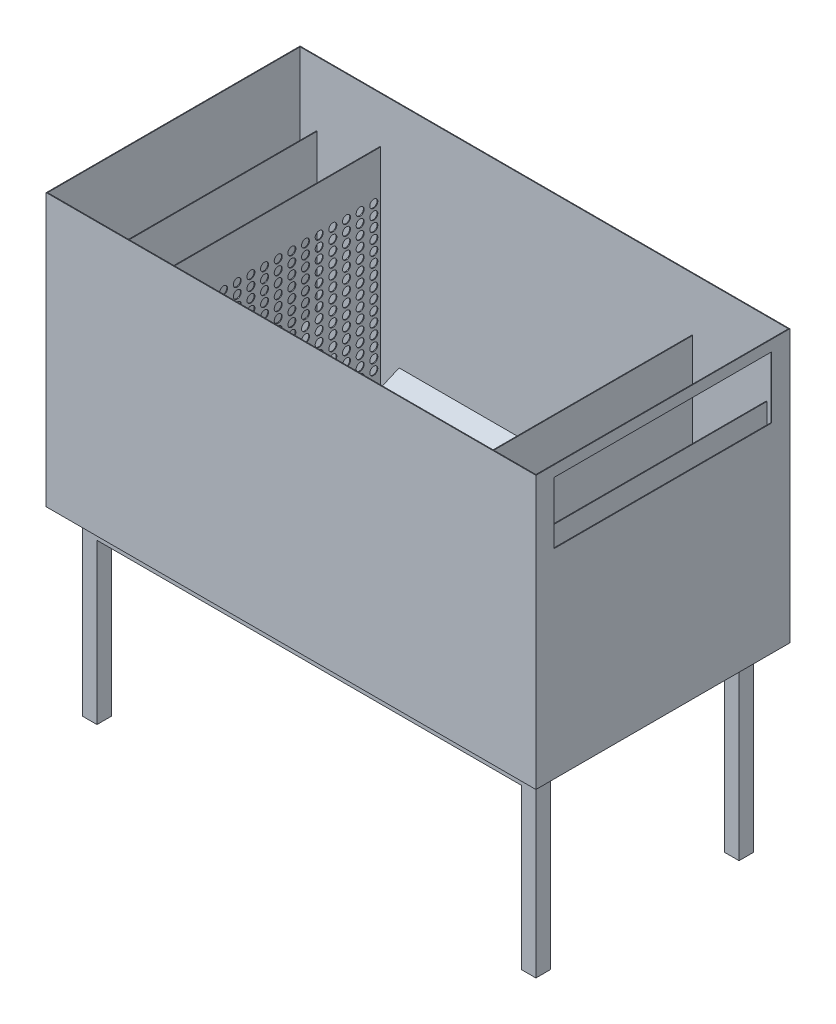
from build123d import *

# Parameters (mm, degrees)
MASTER_FOOTPRINT_W             = 1350
MASTER_FOOTPRINT_H             = 700
BATH_BASE_PLATE_DEPTH          = 750
BATH_SHELL_2MM_T               = -2
SKETCH_1_R                     = 50
INLET_D100_OPENING_DEPTH       = 10
INLET_IMPACT_BAFFLE_START      = 125
SKETCH_2_W                     = 540
SKETCH_2_H                     = 430
INLET_IMPACT_BAFFLE_DEPTH      = 2
DISTRIBUTOR_D22_START          = 250
SKETCH_3_W                     = 640
SKETCH_3_H                     = 648
SKETCH_3_R                     = 11
DISTRIBUTOR_D22_DEPTH          = 2
OUTLET_SUBMERGED_BAFFLE_START  = 1130
SKETCH_4_W                     = 600
SKETCH_4_H                     = 330
OUTLET_SUBMERGED_BAFFLE_DEPTH  = 2
OVERFLOW_WEIR_Z550_START       = 1290
SKETCH_5_W                     = 690
SKETCH_5_H                     = 548
OVERFLOW_WEIR_Z550_DEPTH       = 2
OUTLET_WEIR_SLOT_W600_START    = 1345
SKETCH_6_W                     = 600
SKETCH_6_H                     = 170
OUTLET_WEIR_SLOT_W600_DEPTH    = 10
SLOPED_SEDIMENT_FLOOR_START    = 275
SLOPED_SEDIMENT_FLOOR_DEPTH    = 825
SKETCH_8_W                     = 40
SKETCH_8_H                     = 40
FRAME_FOUR_LEGS_40X40_DEPTH    = 500
FRAME_FOUR_LEGS_40X40_2_DEPTH  = 500
FRAME_FOUR_LEGS_40X40_3_DEPTH  = 500
FRAME_FOUR_LEGS_40X40_4_DEPTH  = 500
FRAME_LONGITUDINAL_RAILS_START = -20
SKETCH_9_W                     = 1250
SKETCH_9_H                     = 40
FRAME_LONGITUDINAL_RAILS_DEPTH = 40


with BuildPart() as part:
    # MASTER_FOOTPRINT → BATH_BASE_PLATE (new body)
    with BuildSketch(Plane(origin=(0, 0, 0), x_dir=(1, 0, 0), z_dir=(0, 1, 0))):
        with Locations((675, 350)):
            Rectangle(MASTER_FOOTPRINT_W, MASTER_FOOTPRINT_H)
    extrude(amount=BATH_BASE_PLATE_DEPTH)

    # BATH_SHELL_2MM
    bath_shell_2mm_openings = [part.faces().sort_by_distance(p)[0] for p in [
        (675, 750, -350),
    ]]
    offset(amount=BATH_SHELL_2MM_T, openings=bath_shell_2mm_openings, kind=Kind.INTERSECTION)

    # Эскиз1 → INLET_D100_OPENING (cut)
    with BuildSketch(Plane(origin=(0, 0, 0), x_dir=(0, 0, -1), z_dir=(1, 0, 0))):
        with Locations((350, 420)):
            Circle(SKETCH_1_R)
    extrude(amount=INLET_D100_OPENING_DEPTH, mode=Mode.SUBTRACT)

    # Эскиз6 → OUTLET_WEIR_SLOT_W600 (cut)
    with BuildSketch(Plane(origin=(0, 0, 0), x_dir=(0, 0, -1), z_dir=(1, 0, 0)).offset(OUTLET_WEIR_SLOT_W600_START)):
        with Locations((350, 635)):
            Rectangle(SKETCH_6_W, SKETCH_6_H)
    extrude(amount=OUTLET_WEIR_SLOT_W600_DEPTH, mode=Mode.SUBTRACT)

    # Эскиз7 → SLOPED_SEDIMENT_FLOOR (add)
    with BuildSketch(Plane(origin=(0, 0, 0), x_dir=(0, 0, -1), z_dir=(1, 0, 0)).offset(SLOPED_SEDIMENT_FLOOR_START)):
        Polygon((2, -1), (2, 120), (280, -1), align=None)
        Polygon((698, -1), (698, 120), (420, -1), align=None)
    extrude(amount=SLOPED_SEDIMENT_FLOOR_DEPTH)


with BuildPart() as body_2:
    # Эскиз2 → INLET_IMPACT_BAFFLE (new body)
    with BuildSketch(Plane(origin=(0, 0, 0), x_dir=(0, 0, -1), z_dir=(1, 0, 0)).offset(INLET_IMPACT_BAFFLE_START)):
        with Locations((350, 435)):
            Rectangle(SKETCH_2_W, SKETCH_2_H)
    extrude(amount=INLET_IMPACT_BAFFLE_DEPTH)


with BuildPart() as body_3:
    # Эскиз3 → DISTRIBUTOR_D22 (new body)
    with BuildSketch(Plane(origin=(0, 0, 0), x_dir=(0, 0, -1), z_dir=(1, 0, 0)).offset(DISTRIBUTOR_D22_START)):
        with Locations((350, 326)):
            Rectangle(SKETCH_3_W, SKETCH_3_H)
        with Locations((48.823529412, 125)):
            Circle(SKETCH_3_R, mode=Mode.SUBTRACT)
        with Locations((48.823529412, 153.5)):
            Circle(SKETCH_3_R, mode=Mode.SUBTRACT)
        with Locations((48.823529412, 182)):
            Circle(SKETCH_3_R, mode=Mode.SUBTRACT)
        with Locations((48.823529412, 210.5)):
            Circle(SKETCH_3_R, mode=Mode.SUBTRACT)
        with Locations((48.823529412, 239)):
            Circle(SKETCH_3_R, mode=Mode.SUBTRACT)
        with Locations((48.823529412, 267.5)):
            Circle(SKETCH_3_R, mode=Mode.SUBTRACT)
        with Locations((48.823529412, 296)):
            Circle(SKETCH_3_R, mode=Mode.SUBTRACT)
        with Locations((48.823529412, 324.5)):
            Circle(SKETCH_3_R, mode=Mode.SUBTRACT)
        with Locations((48.823529412, 353)):
            Circle(SKETCH_3_R, mode=Mode.SUBTRACT)
        with Locations((48.823529412, 381.5)):
            Circle(SKETCH_3_R, mode=Mode.SUBTRACT)
        with Locations((48.823529412, 410)):
            Circle(SKETCH_3_R, mode=Mode.SUBTRACT)
        with Locations((48.823529412, 438.5)):
            Circle(SKETCH_3_R, mode=Mode.SUBTRACT)
        with Locations((48.823529412, 467)):
            Circle(SKETCH_3_R, mode=Mode.SUBTRACT)
        with Locations((48.823529412, 495.5)):
            Circle(SKETCH_3_R, mode=Mode.SUBTRACT)
        with Locations((48.823529412, 524)):
            Circle(SKETCH_3_R, mode=Mode.SUBTRACT)
        with Locations((86.470588235, 125)):
            Circle(SKETCH_3_R, mode=Mode.SUBTRACT)
        with Locations((86.470588235, 153.5)):
            Circle(SKETCH_3_R, mode=Mode.SUBTRACT)
        with Locations((86.470588235, 182)):
            Circle(SKETCH_3_R, mode=Mode.SUBTRACT)
        with Locations((86.470588235, 210.5)):
            Circle(SKETCH_3_R, mode=Mode.SUBTRACT)
        with Locations((86.470588235, 239)):
            Circle(SKETCH_3_R, mode=Mode.SUBTRACT)
        with Locations((86.470588235, 267.5)):
            Circle(SKETCH_3_R, mode=Mode.SUBTRACT)
        with Locations((86.470588235, 296)):
            Circle(SKETCH_3_R, mode=Mode.SUBTRACT)
        with Locations((86.470588235, 324.5)):
            Circle(SKETCH_3_R, mode=Mode.SUBTRACT)
        with Locations((86.470588235, 353)):
            Circle(SKETCH_3_R, mode=Mode.SUBTRACT)
        with Locations((86.470588235, 381.5)):
            Circle(SKETCH_3_R, mode=Mode.SUBTRACT)
        with Locations((86.470588235, 410)):
            Circle(SKETCH_3_R, mode=Mode.SUBTRACT)
        with Locations((86.470588235, 438.5)):
            Circle(SKETCH_3_R, mode=Mode.SUBTRACT)
        with Locations((86.470588235, 467)):
            Circle(SKETCH_3_R, mode=Mode.SUBTRACT)
        with Locations((86.470588235, 495.5)):
            Circle(SKETCH_3_R, mode=Mode.SUBTRACT)
        with Locations((86.470588235, 524)):
            Circle(SKETCH_3_R, mode=Mode.SUBTRACT)
        with Locations((124.117647059, 125)):
            Circle(SKETCH_3_R, mode=Mode.SUBTRACT)
        with Locations((124.117647059, 153.5)):
            Circle(SKETCH_3_R, mode=Mode.SUBTRACT)
        with Locations((124.117647059, 182)):
            Circle(SKETCH_3_R, mode=Mode.SUBTRACT)
        with Locations((124.117647059, 210.5)):
            Circle(SKETCH_3_R, mode=Mode.SUBTRACT)
        with Locations((124.117647059, 239)):
            Circle(SKETCH_3_R, mode=Mode.SUBTRACT)
        with Locations((124.117647059, 267.5)):
            Circle(SKETCH_3_R, mode=Mode.SUBTRACT)
        with Locations((124.117647059, 296)):
            Circle(SKETCH_3_R, mode=Mode.SUBTRACT)
        with Locations((124.117647059, 324.5)):
            Circle(SKETCH_3_R, mode=Mode.SUBTRACT)
        with Locations((124.117647059, 353)):
            Circle(SKETCH_3_R, mode=Mode.SUBTRACT)
        with Locations((124.117647059, 381.5)):
            Circle(SKETCH_3_R, mode=Mode.SUBTRACT)
        with Locations((124.117647059, 410)):
            Circle(SKETCH_3_R, mode=Mode.SUBTRACT)
        with Locations((124.117647059, 438.5)):
            Circle(SKETCH_3_R, mode=Mode.SUBTRACT)
        with Locations((124.117647059, 467)):
            Circle(SKETCH_3_R, mode=Mode.SUBTRACT)
        with Locations((124.117647059, 495.5)):
            Circle(SKETCH_3_R, mode=Mode.SUBTRACT)
        with Locations((124.117647059, 524)):
            Circle(SKETCH_3_R, mode=Mode.SUBTRACT)
        with Locations((161.764705882, 125)):
            Circle(SKETCH_3_R, mode=Mode.SUBTRACT)
        with Locations((161.764705882, 153.5)):
            Circle(SKETCH_3_R, mode=Mode.SUBTRACT)
        with Locations((161.764705882, 182)):
            Circle(SKETCH_3_R, mode=Mode.SUBTRACT)
        with Locations((161.764705882, 210.5)):
            Circle(SKETCH_3_R, mode=Mode.SUBTRACT)
        with Locations((161.764705882, 239)):
            Circle(SKETCH_3_R, mode=Mode.SUBTRACT)
        with Locations((161.764705882, 267.5)):
            Circle(SKETCH_3_R, mode=Mode.SUBTRACT)
        with Locations((161.764705882, 296)):
            Circle(SKETCH_3_R, mode=Mode.SUBTRACT)
        with Locations((161.764705882, 324.5)):
            Circle(SKETCH_3_R, mode=Mode.SUBTRACT)
        with Locations((161.764705882, 353)):
            Circle(SKETCH_3_R, mode=Mode.SUBTRACT)
        with Locations((161.764705882, 381.5)):
            Circle(SKETCH_3_R, mode=Mode.SUBTRACT)
        with Locations((161.764705882, 410)):
            Circle(SKETCH_3_R, mode=Mode.SUBTRACT)
        with Locations((161.764705882, 438.5)):
            Circle(SKETCH_3_R, mode=Mode.SUBTRACT)
        with Locations((161.764705882, 467)):
            Circle(SKETCH_3_R, mode=Mode.SUBTRACT)
        with Locations((161.764705882, 495.5)):
            Circle(SKETCH_3_R, mode=Mode.SUBTRACT)
        with Locations((161.764705882, 524)):
            Circle(SKETCH_3_R, mode=Mode.SUBTRACT)
        with Locations((199.411764706, 125)):
            Circle(SKETCH_3_R, mode=Mode.SUBTRACT)
        with Locations((199.411764706, 153.5)):
            Circle(SKETCH_3_R, mode=Mode.SUBTRACT)
        with Locations((199.411764706, 182)):
            Circle(SKETCH_3_R, mode=Mode.SUBTRACT)
        with Locations((199.411764706, 210.5)):
            Circle(SKETCH_3_R, mode=Mode.SUBTRACT)
        with Locations((199.411764706, 239)):
            Circle(SKETCH_3_R, mode=Mode.SUBTRACT)
        with Locations((199.411764706, 267.5)):
            Circle(SKETCH_3_R, mode=Mode.SUBTRACT)
        with Locations((199.411764706, 296)):
            Circle(SKETCH_3_R, mode=Mode.SUBTRACT)
        with Locations((199.411764706, 324.5)):
            Circle(SKETCH_3_R, mode=Mode.SUBTRACT)
        with Locations((199.411764706, 353)):
            Circle(SKETCH_3_R, mode=Mode.SUBTRACT)
        with Locations((199.411764706, 381.5)):
            Circle(SKETCH_3_R, mode=Mode.SUBTRACT)
        with Locations((199.411764706, 410)):
            Circle(SKETCH_3_R, mode=Mode.SUBTRACT)
        with Locations((199.411764706, 438.5)):
            Circle(SKETCH_3_R, mode=Mode.SUBTRACT)
        with Locations((199.411764706, 467)):
            Circle(SKETCH_3_R, mode=Mode.SUBTRACT)
        with Locations((199.411764706, 495.5)):
            Circle(SKETCH_3_R, mode=Mode.SUBTRACT)
        with Locations((199.411764706, 524)):
            Circle(SKETCH_3_R, mode=Mode.SUBTRACT)
        with Locations((237.058823529, 125)):
            Circle(SKETCH_3_R, mode=Mode.SUBTRACT)
        with Locations((237.058823529, 153.5)):
            Circle(SKETCH_3_R, mode=Mode.SUBTRACT)
        with Locations((237.058823529, 182)):
            Circle(SKETCH_3_R, mode=Mode.SUBTRACT)
        with Locations((237.058823529, 210.5)):
            Circle(SKETCH_3_R, mode=Mode.SUBTRACT)
        with Locations((237.058823529, 239)):
            Circle(SKETCH_3_R, mode=Mode.SUBTRACT)
        with Locations((237.058823529, 267.5)):
            Circle(SKETCH_3_R, mode=Mode.SUBTRACT)
        with Locations((237.058823529, 296)):
            Circle(SKETCH_3_R, mode=Mode.SUBTRACT)
        with Locations((237.058823529, 324.5)):
            Circle(SKETCH_3_R, mode=Mode.SUBTRACT)
        with Locations((237.058823529, 353)):
            Circle(SKETCH_3_R, mode=Mode.SUBTRACT)
        with Locations((237.058823529, 381.5)):
            Circle(SKETCH_3_R, mode=Mode.SUBTRACT)
        with Locations((237.058823529, 410)):
            Circle(SKETCH_3_R, mode=Mode.SUBTRACT)
        with Locations((237.058823529, 438.5)):
            Circle(SKETCH_3_R, mode=Mode.SUBTRACT)
        with Locations((237.058823529, 467)):
            Circle(SKETCH_3_R, mode=Mode.SUBTRACT)
        with Locations((237.058823529, 495.5)):
            Circle(SKETCH_3_R, mode=Mode.SUBTRACT)
        with Locations((237.058823529, 524)):
            Circle(SKETCH_3_R, mode=Mode.SUBTRACT)
        with Locations((274.705882353, 125)):
            Circle(SKETCH_3_R, mode=Mode.SUBTRACT)
        with Locations((274.705882353, 153.5)):
            Circle(SKETCH_3_R, mode=Mode.SUBTRACT)
        with Locations((274.705882353, 182)):
            Circle(SKETCH_3_R, mode=Mode.SUBTRACT)
        with Locations((274.705882353, 210.5)):
            Circle(SKETCH_3_R, mode=Mode.SUBTRACT)
        with Locations((274.705882353, 239)):
            Circle(SKETCH_3_R, mode=Mode.SUBTRACT)
        with Locations((274.705882353, 267.5)):
            Circle(SKETCH_3_R, mode=Mode.SUBTRACT)
        with Locations((274.705882353, 296)):
            Circle(SKETCH_3_R, mode=Mode.SUBTRACT)
        with Locations((274.705882353, 324.5)):
            Circle(SKETCH_3_R, mode=Mode.SUBTRACT)
        with Locations((274.705882353, 353)):
            Circle(SKETCH_3_R, mode=Mode.SUBTRACT)
        with Locations((274.705882353, 381.5)):
            Circle(SKETCH_3_R, mode=Mode.SUBTRACT)
        with Locations((274.705882353, 410)):
            Circle(SKETCH_3_R, mode=Mode.SUBTRACT)
        with Locations((274.705882353, 438.5)):
            Circle(SKETCH_3_R, mode=Mode.SUBTRACT)
        with Locations((274.705882353, 467)):
            Circle(SKETCH_3_R, mode=Mode.SUBTRACT)
        with Locations((274.705882353, 495.5)):
            Circle(SKETCH_3_R, mode=Mode.SUBTRACT)
        with Locations((274.705882353, 524)):
            Circle(SKETCH_3_R, mode=Mode.SUBTRACT)
        with Locations((312.352941176, 125)):
            Circle(SKETCH_3_R, mode=Mode.SUBTRACT)
        with Locations((312.352941176, 153.5)):
            Circle(SKETCH_3_R, mode=Mode.SUBTRACT)
        with Locations((312.352941176, 182)):
            Circle(SKETCH_3_R, mode=Mode.SUBTRACT)
        with Locations((312.352941176, 210.5)):
            Circle(SKETCH_3_R, mode=Mode.SUBTRACT)
        with Locations((312.352941176, 239)):
            Circle(SKETCH_3_R, mode=Mode.SUBTRACT)
        with Locations((312.352941176, 267.5)):
            Circle(SKETCH_3_R, mode=Mode.SUBTRACT)
        with Locations((312.352941176, 296)):
            Circle(SKETCH_3_R, mode=Mode.SUBTRACT)
        with Locations((312.352941176, 324.5)):
            Circle(SKETCH_3_R, mode=Mode.SUBTRACT)
        with Locations((312.352941176, 353)):
            Circle(SKETCH_3_R, mode=Mode.SUBTRACT)
        with Locations((312.352941176, 381.5)):
            Circle(SKETCH_3_R, mode=Mode.SUBTRACT)
        with Locations((312.352941176, 410)):
            Circle(SKETCH_3_R, mode=Mode.SUBTRACT)
        with Locations((312.352941176, 438.5)):
            Circle(SKETCH_3_R, mode=Mode.SUBTRACT)
        with Locations((312.352941176, 467)):
            Circle(SKETCH_3_R, mode=Mode.SUBTRACT)
        with Locations((312.352941176, 495.5)):
            Circle(SKETCH_3_R, mode=Mode.SUBTRACT)
        with Locations((312.352941176, 524)):
            Circle(SKETCH_3_R, mode=Mode.SUBTRACT)
        with Locations((350, 125)):
            Circle(SKETCH_3_R, mode=Mode.SUBTRACT)
        with Locations((350, 153.5)):
            Circle(SKETCH_3_R, mode=Mode.SUBTRACT)
        with Locations((350, 182)):
            Circle(SKETCH_3_R, mode=Mode.SUBTRACT)
        with Locations((350, 210.5)):
            Circle(SKETCH_3_R, mode=Mode.SUBTRACT)
        with Locations((350, 239)):
            Circle(SKETCH_3_R, mode=Mode.SUBTRACT)
        with Locations((350, 267.5)):
            Circle(SKETCH_3_R, mode=Mode.SUBTRACT)
        with Locations((350, 296)):
            Circle(SKETCH_3_R, mode=Mode.SUBTRACT)
        with Locations((350, 324.5)):
            Circle(SKETCH_3_R, mode=Mode.SUBTRACT)
        with Locations((350, 353)):
            Circle(SKETCH_3_R, mode=Mode.SUBTRACT)
        with Locations((350, 381.5)):
            Circle(SKETCH_3_R, mode=Mode.SUBTRACT)
        with Locations((350, 410)):
            Circle(SKETCH_3_R, mode=Mode.SUBTRACT)
        with Locations((350, 438.5)):
            Circle(SKETCH_3_R, mode=Mode.SUBTRACT)
        with Locations((350, 467)):
            Circle(SKETCH_3_R, mode=Mode.SUBTRACT)
        with Locations((350, 495.5)):
            Circle(SKETCH_3_R, mode=Mode.SUBTRACT)
        with Locations((350, 524)):
            Circle(SKETCH_3_R, mode=Mode.SUBTRACT)
        with Locations((387.647058824, 125)):
            Circle(SKETCH_3_R, mode=Mode.SUBTRACT)
        with Locations((387.647058824, 153.5)):
            Circle(SKETCH_3_R, mode=Mode.SUBTRACT)
        with Locations((387.647058824, 182)):
            Circle(SKETCH_3_R, mode=Mode.SUBTRACT)
        with Locations((387.647058824, 210.5)):
            Circle(SKETCH_3_R, mode=Mode.SUBTRACT)
        with Locations((387.647058824, 239)):
            Circle(SKETCH_3_R, mode=Mode.SUBTRACT)
        with Locations((387.647058824, 267.5)):
            Circle(SKETCH_3_R, mode=Mode.SUBTRACT)
        with Locations((387.647058824, 296)):
            Circle(SKETCH_3_R, mode=Mode.SUBTRACT)
        with Locations((387.647058824, 324.5)):
            Circle(SKETCH_3_R, mode=Mode.SUBTRACT)
        with Locations((387.647058824, 353)):
            Circle(SKETCH_3_R, mode=Mode.SUBTRACT)
        with Locations((387.647058824, 381.5)):
            Circle(SKETCH_3_R, mode=Mode.SUBTRACT)
        with Locations((387.647058824, 410)):
            Circle(SKETCH_3_R, mode=Mode.SUBTRACT)
        with Locations((387.647058824, 438.5)):
            Circle(SKETCH_3_R, mode=Mode.SUBTRACT)
        with Locations((387.647058824, 467)):
            Circle(SKETCH_3_R, mode=Mode.SUBTRACT)
        with Locations((387.647058824, 495.5)):
            Circle(SKETCH_3_R, mode=Mode.SUBTRACT)
        with Locations((387.647058824, 524)):
            Circle(SKETCH_3_R, mode=Mode.SUBTRACT)
        with Locations((425.294117647, 125)):
            Circle(SKETCH_3_R, mode=Mode.SUBTRACT)
        with Locations((425.294117647, 153.5)):
            Circle(SKETCH_3_R, mode=Mode.SUBTRACT)
        with Locations((425.294117647, 182)):
            Circle(SKETCH_3_R, mode=Mode.SUBTRACT)
        with Locations((425.294117647, 210.5)):
            Circle(SKETCH_3_R, mode=Mode.SUBTRACT)
        with Locations((425.294117647, 239)):
            Circle(SKETCH_3_R, mode=Mode.SUBTRACT)
        with Locations((425.294117647, 267.5)):
            Circle(SKETCH_3_R, mode=Mode.SUBTRACT)
        with Locations((425.294117647, 296)):
            Circle(SKETCH_3_R, mode=Mode.SUBTRACT)
        with Locations((425.294117647, 324.5)):
            Circle(SKETCH_3_R, mode=Mode.SUBTRACT)
        with Locations((425.294117647, 353)):
            Circle(SKETCH_3_R, mode=Mode.SUBTRACT)
        with Locations((425.294117647, 381.5)):
            Circle(SKETCH_3_R, mode=Mode.SUBTRACT)
        with Locations((425.294117647, 410)):
            Circle(SKETCH_3_R, mode=Mode.SUBTRACT)
        with Locations((425.294117647, 438.5)):
            Circle(SKETCH_3_R, mode=Mode.SUBTRACT)
        with Locations((425.294117647, 467)):
            Circle(SKETCH_3_R, mode=Mode.SUBTRACT)
        with Locations((425.294117647, 495.5)):
            Circle(SKETCH_3_R, mode=Mode.SUBTRACT)
        with Locations((425.294117647, 524)):
            Circle(SKETCH_3_R, mode=Mode.SUBTRACT)
        with Locations((462.941176471, 125)):
            Circle(SKETCH_3_R, mode=Mode.SUBTRACT)
        with Locations((462.941176471, 153.5)):
            Circle(SKETCH_3_R, mode=Mode.SUBTRACT)
        with Locations((462.941176471, 182)):
            Circle(SKETCH_3_R, mode=Mode.SUBTRACT)
        with Locations((462.941176471, 210.5)):
            Circle(SKETCH_3_R, mode=Mode.SUBTRACT)
        with Locations((462.941176471, 239)):
            Circle(SKETCH_3_R, mode=Mode.SUBTRACT)
        with Locations((462.941176471, 267.5)):
            Circle(SKETCH_3_R, mode=Mode.SUBTRACT)
        with Locations((462.941176471, 296)):
            Circle(SKETCH_3_R, mode=Mode.SUBTRACT)
        with Locations((462.941176471, 324.5)):
            Circle(SKETCH_3_R, mode=Mode.SUBTRACT)
        with Locations((462.941176471, 353)):
            Circle(SKETCH_3_R, mode=Mode.SUBTRACT)
        with Locations((462.941176471, 381.5)):
            Circle(SKETCH_3_R, mode=Mode.SUBTRACT)
        with Locations((462.941176471, 410)):
            Circle(SKETCH_3_R, mode=Mode.SUBTRACT)
        with Locations((462.941176471, 438.5)):
            Circle(SKETCH_3_R, mode=Mode.SUBTRACT)
        with Locations((462.941176471, 467)):
            Circle(SKETCH_3_R, mode=Mode.SUBTRACT)
        with Locations((462.941176471, 495.5)):
            Circle(SKETCH_3_R, mode=Mode.SUBTRACT)
        with Locations((462.941176471, 524)):
            Circle(SKETCH_3_R, mode=Mode.SUBTRACT)
        with Locations((500.588235294, 125)):
            Circle(SKETCH_3_R, mode=Mode.SUBTRACT)
        with Locations((500.588235294, 153.5)):
            Circle(SKETCH_3_R, mode=Mode.SUBTRACT)
        with Locations((500.588235294, 182)):
            Circle(SKETCH_3_R, mode=Mode.SUBTRACT)
        with Locations((500.588235294, 210.5)):
            Circle(SKETCH_3_R, mode=Mode.SUBTRACT)
        with Locations((500.588235294, 239)):
            Circle(SKETCH_3_R, mode=Mode.SUBTRACT)
        with Locations((500.588235294, 267.5)):
            Circle(SKETCH_3_R, mode=Mode.SUBTRACT)
        with Locations((500.588235294, 296)):
            Circle(SKETCH_3_R, mode=Mode.SUBTRACT)
        with Locations((500.588235294, 324.5)):
            Circle(SKETCH_3_R, mode=Mode.SUBTRACT)
        with Locations((500.588235294, 353)):
            Circle(SKETCH_3_R, mode=Mode.SUBTRACT)
        with Locations((500.588235294, 381.5)):
            Circle(SKETCH_3_R, mode=Mode.SUBTRACT)
        with Locations((500.588235294, 410)):
            Circle(SKETCH_3_R, mode=Mode.SUBTRACT)
        with Locations((500.588235294, 438.5)):
            Circle(SKETCH_3_R, mode=Mode.SUBTRACT)
        with Locations((500.588235294, 467)):
            Circle(SKETCH_3_R, mode=Mode.SUBTRACT)
        with Locations((500.588235294, 495.5)):
            Circle(SKETCH_3_R, mode=Mode.SUBTRACT)
        with Locations((500.588235294, 524)):
            Circle(SKETCH_3_R, mode=Mode.SUBTRACT)
        with Locations((538.235294118, 125)):
            Circle(SKETCH_3_R, mode=Mode.SUBTRACT)
        with Locations((538.235294118, 153.5)):
            Circle(SKETCH_3_R, mode=Mode.SUBTRACT)
        with Locations((538.235294118, 182)):
            Circle(SKETCH_3_R, mode=Mode.SUBTRACT)
        with Locations((538.235294118, 210.5)):
            Circle(SKETCH_3_R, mode=Mode.SUBTRACT)
        with Locations((538.235294118, 239)):
            Circle(SKETCH_3_R, mode=Mode.SUBTRACT)
        with Locations((538.235294118, 267.5)):
            Circle(SKETCH_3_R, mode=Mode.SUBTRACT)
        with Locations((538.235294118, 296)):
            Circle(SKETCH_3_R, mode=Mode.SUBTRACT)
        with Locations((538.235294118, 324.5)):
            Circle(SKETCH_3_R, mode=Mode.SUBTRACT)
        with Locations((538.235294118, 353)):
            Circle(SKETCH_3_R, mode=Mode.SUBTRACT)
        with Locations((538.235294118, 381.5)):
            Circle(SKETCH_3_R, mode=Mode.SUBTRACT)
        with Locations((538.235294118, 410)):
            Circle(SKETCH_3_R, mode=Mode.SUBTRACT)
        with Locations((538.235294118, 438.5)):
            Circle(SKETCH_3_R, mode=Mode.SUBTRACT)
        with Locations((538.235294118, 467)):
            Circle(SKETCH_3_R, mode=Mode.SUBTRACT)
        with Locations((538.235294118, 495.5)):
            Circle(SKETCH_3_R, mode=Mode.SUBTRACT)
        with Locations((538.235294118, 524)):
            Circle(SKETCH_3_R, mode=Mode.SUBTRACT)
        with Locations((575.882352941, 125)):
            Circle(SKETCH_3_R, mode=Mode.SUBTRACT)
        with Locations((575.882352941, 153.5)):
            Circle(SKETCH_3_R, mode=Mode.SUBTRACT)
        with Locations((575.882352941, 182)):
            Circle(SKETCH_3_R, mode=Mode.SUBTRACT)
        with Locations((575.882352941, 210.5)):
            Circle(SKETCH_3_R, mode=Mode.SUBTRACT)
        with Locations((575.882352941, 239)):
            Circle(SKETCH_3_R, mode=Mode.SUBTRACT)
        with Locations((575.882352941, 267.5)):
            Circle(SKETCH_3_R, mode=Mode.SUBTRACT)
        with Locations((575.882352941, 296)):
            Circle(SKETCH_3_R, mode=Mode.SUBTRACT)
        with Locations((575.882352941, 324.5)):
            Circle(SKETCH_3_R, mode=Mode.SUBTRACT)
        with Locations((575.882352941, 353)):
            Circle(SKETCH_3_R, mode=Mode.SUBTRACT)
        with Locations((575.882352941, 381.5)):
            Circle(SKETCH_3_R, mode=Mode.SUBTRACT)
        with Locations((575.882352941, 410)):
            Circle(SKETCH_3_R, mode=Mode.SUBTRACT)
        with Locations((575.882352941, 438.5)):
            Circle(SKETCH_3_R, mode=Mode.SUBTRACT)
        with Locations((575.882352941, 467)):
            Circle(SKETCH_3_R, mode=Mode.SUBTRACT)
        with Locations((575.882352941, 495.5)):
            Circle(SKETCH_3_R, mode=Mode.SUBTRACT)
        with Locations((575.882352941, 524)):
            Circle(SKETCH_3_R, mode=Mode.SUBTRACT)
        with Locations((613.529411765, 125)):
            Circle(SKETCH_3_R, mode=Mode.SUBTRACT)
        with Locations((613.529411765, 153.5)):
            Circle(SKETCH_3_R, mode=Mode.SUBTRACT)
        with Locations((613.529411765, 182)):
            Circle(SKETCH_3_R, mode=Mode.SUBTRACT)
        with Locations((613.529411765, 210.5)):
            Circle(SKETCH_3_R, mode=Mode.SUBTRACT)
        with Locations((613.529411765, 239)):
            Circle(SKETCH_3_R, mode=Mode.SUBTRACT)
        with Locations((613.529411765, 267.5)):
            Circle(SKETCH_3_R, mode=Mode.SUBTRACT)
        with Locations((613.529411765, 296)):
            Circle(SKETCH_3_R, mode=Mode.SUBTRACT)
        with Locations((613.529411765, 324.5)):
            Circle(SKETCH_3_R, mode=Mode.SUBTRACT)
        with Locations((613.529411765, 353)):
            Circle(SKETCH_3_R, mode=Mode.SUBTRACT)
        with Locations((613.529411765, 381.5)):
            Circle(SKETCH_3_R, mode=Mode.SUBTRACT)
        with Locations((613.529411765, 410)):
            Circle(SKETCH_3_R, mode=Mode.SUBTRACT)
        with Locations((613.529411765, 438.5)):
            Circle(SKETCH_3_R, mode=Mode.SUBTRACT)
        with Locations((613.529411765, 467)):
            Circle(SKETCH_3_R, mode=Mode.SUBTRACT)
        with Locations((613.529411765, 495.5)):
            Circle(SKETCH_3_R, mode=Mode.SUBTRACT)
        with Locations((613.529411765, 524)):
            Circle(SKETCH_3_R, mode=Mode.SUBTRACT)
        with Locations((651.176470588, 125)):
            Circle(SKETCH_3_R, mode=Mode.SUBTRACT)
        with Locations((651.176470588, 153.5)):
            Circle(SKETCH_3_R, mode=Mode.SUBTRACT)
        with Locations((651.176470588, 182)):
            Circle(SKETCH_3_R, mode=Mode.SUBTRACT)
        with Locations((651.176470588, 210.5)):
            Circle(SKETCH_3_R, mode=Mode.SUBTRACT)
        with Locations((651.176470588, 239)):
            Circle(SKETCH_3_R, mode=Mode.SUBTRACT)
        with Locations((651.176470588, 267.5)):
            Circle(SKETCH_3_R, mode=Mode.SUBTRACT)
        with Locations((651.176470588, 296)):
            Circle(SKETCH_3_R, mode=Mode.SUBTRACT)
        with Locations((651.176470588, 324.5)):
            Circle(SKETCH_3_R, mode=Mode.SUBTRACT)
        with Locations((651.176470588, 353)):
            Circle(SKETCH_3_R, mode=Mode.SUBTRACT)
        with Locations((651.176470588, 381.5)):
            Circle(SKETCH_3_R, mode=Mode.SUBTRACT)
        with Locations((651.176470588, 410)):
            Circle(SKETCH_3_R, mode=Mode.SUBTRACT)
        with Locations((651.176470588, 438.5)):
            Circle(SKETCH_3_R, mode=Mode.SUBTRACT)
        with Locations((651.176470588, 467)):
            Circle(SKETCH_3_R, mode=Mode.SUBTRACT)
        with Locations((651.176470588, 495.5)):
            Circle(SKETCH_3_R, mode=Mode.SUBTRACT)
        with Locations((651.176470588, 524)):
            Circle(SKETCH_3_R, mode=Mode.SUBTRACT)
    extrude(amount=DISTRIBUTOR_D22_DEPTH)


with BuildPart() as body_4:
    # Эскиз4 → OUTLET_SUBMERGED_BAFFLE (new body)
    with BuildSketch(Plane(origin=(0, 0, 0), x_dir=(0, 0, -1), z_dir=(1, 0, 0)).offset(OUTLET_SUBMERGED_BAFFLE_START)):
        with Locations((350, 485)):
            Rectangle(SKETCH_4_W, SKETCH_4_H)
    extrude(amount=OUTLET_SUBMERGED_BAFFLE_DEPTH)


with BuildPart() as body_5:
    # Эскиз5 → OVERFLOW_WEIR_Z550 (new body)
    with BuildSketch(Plane(origin=(0, 0, 0), x_dir=(0, 0, -1), z_dir=(1, 0, 0)).offset(OVERFLOW_WEIR_Z550_START)):
        with Locations((350, 276)):
            Rectangle(SKETCH_5_W, SKETCH_5_H)
    extrude(amount=OVERFLOW_WEIR_Z550_DEPTH)


with BuildPart() as body_6:
    # Эскиз8 → FRAME_FOUR_LEGS_40X40 (new body)
    with BuildSketch(Plane(origin=(0, 0, 0), x_dir=(1, 0, 0), z_dir=(0, 1, 0))):
        with Locations((70, 70)):
            Rectangle(SKETCH_8_W, SKETCH_8_H)
    extrude(amount=-FRAME_FOUR_LEGS_40X40_DEPTH)



with BuildPart() as body_7:
    # Эскиз8 → FRAME_FOUR_LEGS_40X40 2 (new body)
    with BuildSketch(Plane(origin=(0, 0, 0), x_dir=(1, 0, 0), z_dir=(0, 1, 0))):
        with Locations((70, 630)):
            Rectangle(SKETCH_8_W, SKETCH_8_H)
    extrude(amount=-FRAME_FOUR_LEGS_40X40_2_DEPTH)


with BuildPart() as body_8:
    # Эскиз8 → FRAME_FOUR_LEGS_40X40 3 (new body)
    with BuildSketch(Plane(origin=(0, 0, 0), x_dir=(1, 0, 0), z_dir=(0, 1, 0))):
        with Locations((1280, 70)):
            Rectangle(SKETCH_8_W, SKETCH_8_H)
    extrude(amount=-FRAME_FOUR_LEGS_40X40_3_DEPTH)


with BuildPart() as body_9:
    # Эскиз8 → FRAME_FOUR_LEGS_40X40 4 (new body)
    with BuildSketch(Plane(origin=(0, 0, 0), x_dir=(1, 0, 0), z_dir=(0, 1, 0))):
        with Locations((1280, 630)):
            Rectangle(SKETCH_8_W, SKETCH_8_H)
    extrude(amount=-FRAME_FOUR_LEGS_40X40_4_DEPTH)


with BuildPart() as body_6_1:
    add(body_6.part)

    add(body_7.part)  # FRAME_LONGITUDINAL_RAILS merges body 7

    add(body_8.part)  # FRAME_LONGITUDINAL_RAILS merges body 8

    add(body_9.part)  # FRAME_LONGITUDINAL_RAILS merges body 9
    # Эскиз9 → FRAME_LONGITUDINAL_RAILS (add)
    with BuildSketch(Plane(origin=(0, 0, 0), x_dir=(1, 0, 0), z_dir=(0, 1, 0)).offset(FRAME_LONGITUDINAL_RAILS_START)):
        with Locations((675, 70)):
            Rectangle(SKETCH_9_W, SKETCH_9_H)
        with Locations((675, 630)):
            Rectangle(SKETCH_9_W, SKETCH_9_H)
    extrude(amount=-FRAME_LONGITUDINAL_RAILS_DEPTH)


solid = Compound([part.part, body_2.part, body_3.part, body_4.part, body_5.part, body_6_1.part])
